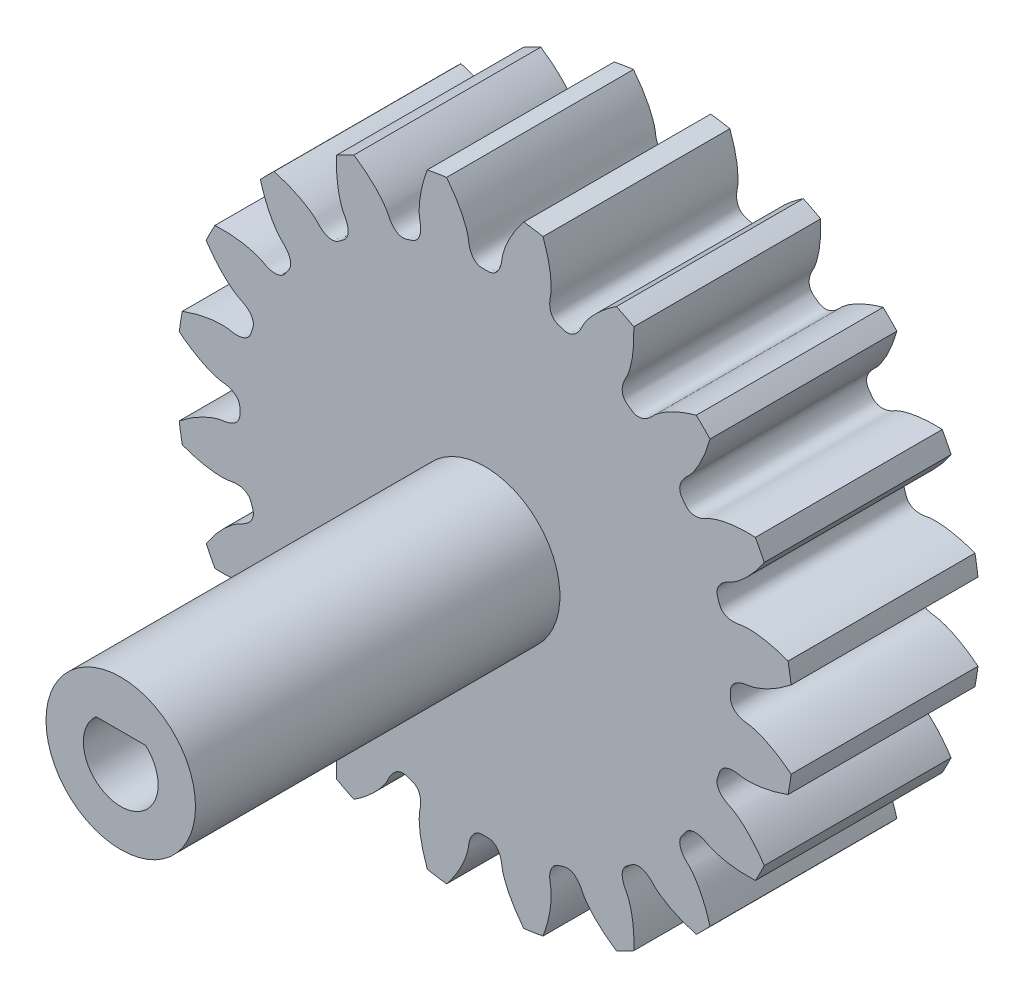
from build123d import *

# Parameters (mm, degrees)
SKETCHREVOLVESPURASSEMBLY01PINION_W       = 10
SKETCHREVOLVESPURASSEMBLY01PINION_H       = 16.499999752
TOOTHEXTRUDECUTSPURASSEMBLY01PINION_DEPTH = 5
PATTERNSPURASSEMBLY01PINION_COUNT         = 20
SKETCH1_R                                 = 4
BOSS_EXTRUDE1_DEPTH                       = 19.5
CUT_EXTRUDE5_DEPTH                        = 8
BOSS_EXTRUDE5_START                       = 5
SKETCH8_R                                 = 4
BOSS_EXTRUDE5_DEPTH                       = 5


with BuildPart() as part:
    # SketchRevolveSpurAssembly01Pinion → SpurAssembly01Pinion (revolve)
    with BuildSketch(Plane(origin=(0, 0, 0), x_dir=(0, 0, -1), z_dir=(1, 0, 0))):
        with Locations((0, 8.249999876)):
            Rectangle(SKETCHREVOLVESPURASSEMBLY01PINION_W, SKETCHREVOLVESPURASSEMBLY01PINION_H)
    revolve(axis=Axis((0, 0, 0), (0, 0, -1)))

    # SketchToothSpurAssembly01Pinion → ToothExtrudeCutSpurAssembly01Pinion (cut, symmetric)
    with BuildSketch(Plane.XY):
        with BuildLine():
            ThreePointArc((16.438815928, 2.120364973), (16.574999751, 0), (16.438815928, -2.120364973))
            add(Edge.make_bspline(
                [(16.438815928, -2.120364973), (16.306213447, -2.012632117), (16.10792267, -1.860929635), (15.841705586, -1.676668952), (15.654853966, -1.55570694), (15.475899367, -1.447553762), (15.305444286, -1.351598726), (15.144060802, -1.267206194), (14.992289617, -1.193717223), (14.850639167, -1.130450865), (14.719584807, -1.0767054), (14.599567969, -1.031760257), (14.490995634, -0.99487577), (14.394239041, -0.965299916), (14.309634999, -0.942253529), (14.237479548, -0.924980687), (14.178044201, -0.912608864), (14.049223501, -0.890261122), (13.912281496, -0.878231728), (13.769652297, -0.842658369), (13.695599357, -0.820644128), (13.624377747, -0.794966749), (13.555692175, -0.765356143), (13.489258635, -0.731124882), (13.424830796, -0.691333031), (13.362331646, -0.644635632), (13.30209452, -0.589245233), (13.24524803, -0.523019137), (13.194309632, -0.443877425), (13.153279262, -0.350864326), (13.130262908, -0.253354669), (13.120821868, -0.134969136), (13.12767395, 0), (13.120821868, 0.134969136), (13.130262908, 0.253354669), (13.153279262, 0.350864326), (13.194309632, 0.443877425), (13.24524803, 0.523019137), (13.30209452, 0.589245233), (13.362331646, 0.644635632), (13.424830796, 0.691333031), (13.489258635, 0.731124882), (13.555692175, 0.765356143), (13.624377747, 0.794966749), (13.695599357, 0.820644128), (13.769652297, 0.842658369), (13.912281496, 0.878231728), (14.049223501, 0.890261122), (14.178044201, 0.912608864), (14.237479548, 0.924980687), (14.309634999, 0.942253529), (14.394239041, 0.965299916), (14.490995634, 0.99487577), (14.599567969, 1.031760257), (14.719584807, 1.0767054), (14.850639167, 1.130450865), (14.992289617, 1.193717223), (15.144060802, 1.267206194), (15.305444286, 1.351598726), (15.475899367, 1.447553762), (15.654853966, 1.55570694), (15.841705586, 1.676668952), (16.10792267, 1.860929635), (16.306213447, 2.012632117), (16.438815928, 2.120364973)],
                knots=[0, 0, 0, 0, 0.061422842, 0.089709677, 0.116380121, 0.141434175, 0.164871838, 0.186693111, 0.206897994, 0.225486485, 0.242458587, 0.257814298, 0.271553618, 0.283676548, 0.294183087, 0.303073236, 0.310346995, 0.316004363, 0.350076802, 0.359567688, 0.36880314, 0.37784437, 0.386769007, 0.395675631, 0.404688756, 0.413962948, 0.423682731, 0.434051196, 0.445255861, 0.457401439, 0.47041984, 0.481066796, 0.5, 0.518933204, 0.52958016, 0.542598561, 0.554744139, 0.565948804, 0.576317269, 0.586037052, 0.595311244, 0.604324369, 0.613230993, 0.62215563, 0.63119686, 0.640432312, 0.649923198, 0.683995637, 0.689653005, 0.696926764, 0.705816913, 0.716323452, 0.728446382, 0.742185702, 0.757541413, 0.774513515, 0.793102006, 0.813306889, 0.835128162, 0.858565825, 0.883619879, 0.910290323, 0.938577158, 1, 1, 1, 1], degree=3))
        make_face()
    toothextrudecutspurassembly01pinion = extrude(amount=TOOTHEXTRUDECUTSPURASSEMBLY01PINION_DEPTH, both=True, mode=Mode.SUBTRACT)

    # PatternSpurAssembly01Pinion: ToothExtrudeCutSpurAssembly01Pinion ×20 about axis
    patternspurassembly01pinion_axis = Axis((0, 0, 55), (0, 0, -1))
    for i in range(1, PATTERNSPURASSEMBLY01PINION_COUNT):
        add(toothextrudecutspurassembly01pinion.rotate(patternspurassembly01pinion_axis, i * 360 / PATTERNSPURASSEMBLY01PINION_COUNT), mode=Mode.SUBTRACT)

    # Sketch1 → Boss-Extrude1 (add)
    with BuildSketch(Plane.XY.offset(5)):
        Circle(SKETCH1_R)
    extrude(amount=BOSS_EXTRUDE1_DEPTH)

    # Sketch7 → Cut-Extrude5 (cut)
    with BuildSketch(Plane.XY.offset(24.5)):
        with BuildLine():
            Line((1.322875656, 1.5), (-1.322875656, 1.5))
            ThreePointArc((-1.322875656, 1.5), (0, -2), (1.322875656, 1.5))
        make_face()
    extrude(amount=-CUT_EXTRUDE5_DEPTH, mode=Mode.SUBTRACT)

    # Sketch8 → Boss-Extrude5 (add)
    with BuildSketch(Plane(origin=(0, 0, -5), x_dir=(-1, 0, 0), z_dir=(0, 0, -1)).offset(BOSS_EXTRUDE5_START)):
        Circle(SKETCH8_R)
    extrude(amount=-BOSS_EXTRUDE5_DEPTH)


solid = part.part
